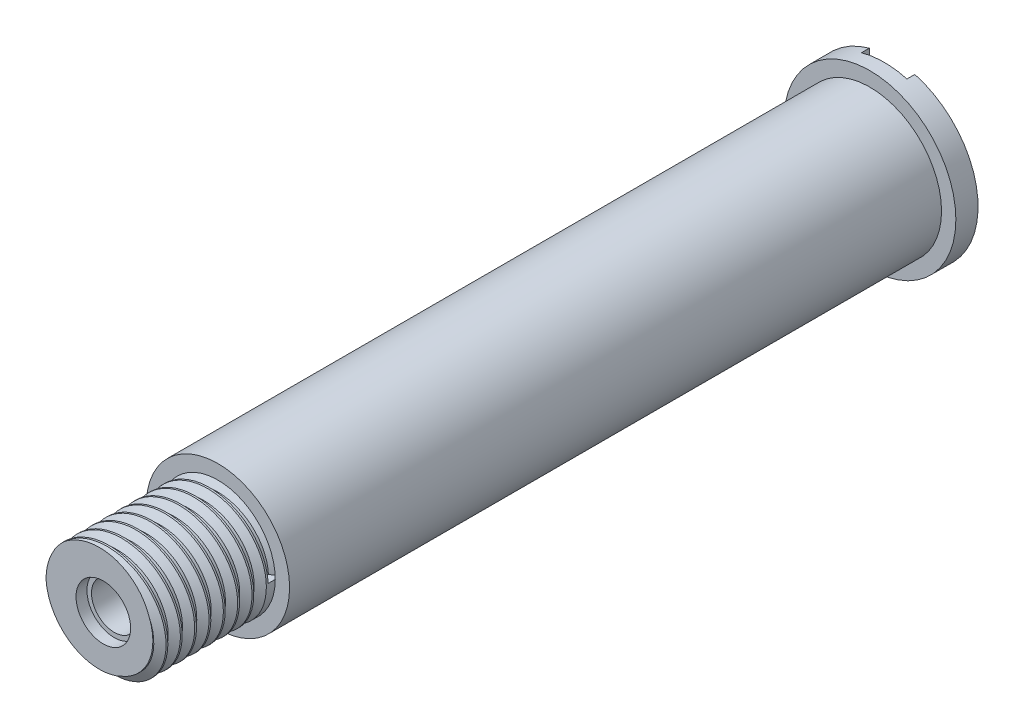
from build123d import *

# Parameters (mm, degrees)
SKETCH2_R               = 6
BOSS_EXTRUDE1_DEPTH     = 55.05
CUT_EXTRUDE1_DEPTH      = 1
CUT_EXTRUDE1_DEPTH_BACK = 53.5
SKETCH3_R               = 6
SKETCH3_R_2             = 5
SKETCH4_R               = 3.175
CUT_EXTRUDE2_DEPTH      = 46
SKETCH6_R               = 1.5875
CUT_EXTRUDE3_DEPTH      = 75.718
SKETCH7_R               = 1.905
CUT_EXTRUDE4_DEPTH      = 0.762
CUT_EXTRUDE5_DEPTH      = 0.55
SKETCH9_R               = 5
SKETCH9_R_2             = 4
CUT_EXTRUDE6_DEPTH      = 8
THREAD1_PITCH           = 1


with BuildPart() as part:
    # Sketch2 → Boss-Extrude1 (new body)
    with BuildSketch(Plane.XY):
        Circle(SKETCH2_R)
    extrude(amount=BOSS_EXTRUDE1_DEPTH)

    # Sketch3 → Cut-Extrude1 (cut, two sides: drawn at the far end of the back side and taken through both)
    with BuildSketch(Plane.XY.offset(55.05).offset(-CUT_EXTRUDE1_DEPTH_BACK)):
        Circle(SKETCH3_R)
        Circle(SKETCH3_R_2, mode=Mode.SUBTRACT)
    extrude(amount=CUT_EXTRUDE1_DEPTH + CUT_EXTRUDE1_DEPTH_BACK, mode=Mode.SUBTRACT)

    # Sketch4 → Cut-Extrude2 (cut)
    with BuildSketch(Plane(origin=(0, 0, 0), x_dir=(-1, 0, 0), z_dir=(0, 0, -1))):
        Circle(SKETCH4_R)
    extrude(amount=-CUT_EXTRUDE2_DEPTH, mode=Mode.SUBTRACT)

    # Sketch6 → Cut-Extrude3 (cut)
    with BuildSketch(Plane.XY.offset(55.05)):
        Circle(SKETCH6_R)
    extrude(amount=-CUT_EXTRUDE3_DEPTH, mode=Mode.SUBTRACT)

    # Sketch7 → Cut-Extrude4 (cut)
    with BuildSketch(Plane.XY.offset(55.05)):
        Circle(SKETCH7_R)
    extrude(amount=-CUT_EXTRUDE4_DEPTH, mode=Mode.SUBTRACT)

    # Sketch8 → Cut-Extrude5 (cut)
    with BuildSketch(Plane(origin=(0, 0, 0), x_dir=(-1, 0, 0), z_dir=(0, 0, -1))):
        Polygon((0, 0), (1.5875, 0), (1.5875, 10.42336745), (-1.5875, 10.42336745), (-1.5875, 0), align=None)
    extrude(amount=-CUT_EXTRUDE5_DEPTH, mode=Mode.SUBTRACT)

    # Sketch9 → Cut-Extrude6 (cut)
    with BuildSketch(Plane.XY.offset(55.05)):
        Circle(SKETCH9_R)
        Circle(SKETCH9_R_2, mode=Mode.SUBTRACT)
    extrude(amount=-CUT_EXTRUDE6_DEPTH, mode=Mode.SUBTRACT)

    # Thread1: the profile of Thread Profile1 profile screwed along a right-hand helix of 8.5 turns, 8 arcs to a turn; built about Z, then put on its axis
    thread1_z = Axis((0, 0, 0), (0, 0, 1))
    thread1_corners = [(4.0003, 0, -0.000173205), (4.0003, 0, 0.875173202), (3.458734125, 0, 0.562499999), (3.458734125, 0, 0.312499999)]
    with BuildLine(mode=Mode.PRIVATE) as thread1_profile:
        Line(thread1_corners[0], thread1_corners[1])
        Line(thread1_corners[1], thread1_corners[2])
        Line(thread1_corners[2], thread1_corners[3])
        Line(thread1_corners[3], thread1_corners[0])
    thread1_cap = Face(thread1_profile.wire())
    thread1_turn_angles = [0, 22.5, 45, 67.5, 90, 112.5, 135, 157.5, 180, 202.5, 225, 247.5, 270, 292.5, 315, 337.5, 360]
    thread1_turn_weights = [1, 0.9238795325112867, 1, 0.9238795325112867, 1, 0.9238795325112867, 1, 0.9238795325112867, 1, 0.9238795325112867, 1, 0.9238795325112867, 1, 0.9238795325112867, 1, 0.9238795325112867, 1]
    thread1_turn_rails = [Edge.make_bspline([Vector(p[0], p[1], 0).rotate(thread1_z, thread1_turn_angles[k]) / thread1_turn_weights[k] + Vector(0, 0, p[2] + THREAD1_PITCH * thread1_turn_angles[k] / 360) for k in range(17)], [0, 0, 0, 1, 1, 2, 2, 3, 3, 4, 4, 5, 5, 6, 6, 7, 7, 8, 8, 8], 2, thread1_turn_weights) for p in thread1_corners]
    thread1_turn_sides = [Face.make_surface_from_curves(thread1_turn_rails[p[0]], thread1_turn_rails[p[1]]) for p in [(0, 1), (1, 2), (2, 3), (3, 0)]]
    thread1_last_angles = [2880, 2902.5, 2925, 2947.5, 2970, 2992.5, 3015, 3037.5, 3060]
    thread1_last_weights = [1, 0.9238795325112867, 1, 0.9238795325112867, 1, 0.9238795325112867, 1, 0.9238795325112867, 1]
    thread1_last_rails = [Edge.make_bspline([Vector(p[0], p[1], 0).rotate(thread1_z, thread1_last_angles[k]) / thread1_last_weights[k] + Vector(0, 0, p[2] + THREAD1_PITCH * thread1_last_angles[k] / 360) for k in range(9)], [0, 0, 0, 1, 1, 2, 2, 3, 3, 4, 4, 4], 2, thread1_last_weights) for p in thread1_corners]
    thread1_last_sides = [Face.make_surface_from_curves(thread1_last_rails[p[0]], thread1_last_rails[p[1]]) for p in [(0, 1), (1, 2), (2, 3), (3, 0)]]
    thread1 = Plane(origin=(0, 0, 56.05), x_dir=(-1, 0, 0), z_dir=(0, 0, -1)) * Solid(Shell([*[p.moved(Location((0, 0, THREAD1_PITCH * i))) for i in range(8) for p in thread1_turn_sides], *thread1_last_sides, thread1_cap, thread1_cap.rotate(thread1_z, 3060).moved(Location((0, 0, THREAD1_PITCH * 3060 / 360)))]))
    add(thread1, mode=Mode.SUBTRACT)


solid = part.part
